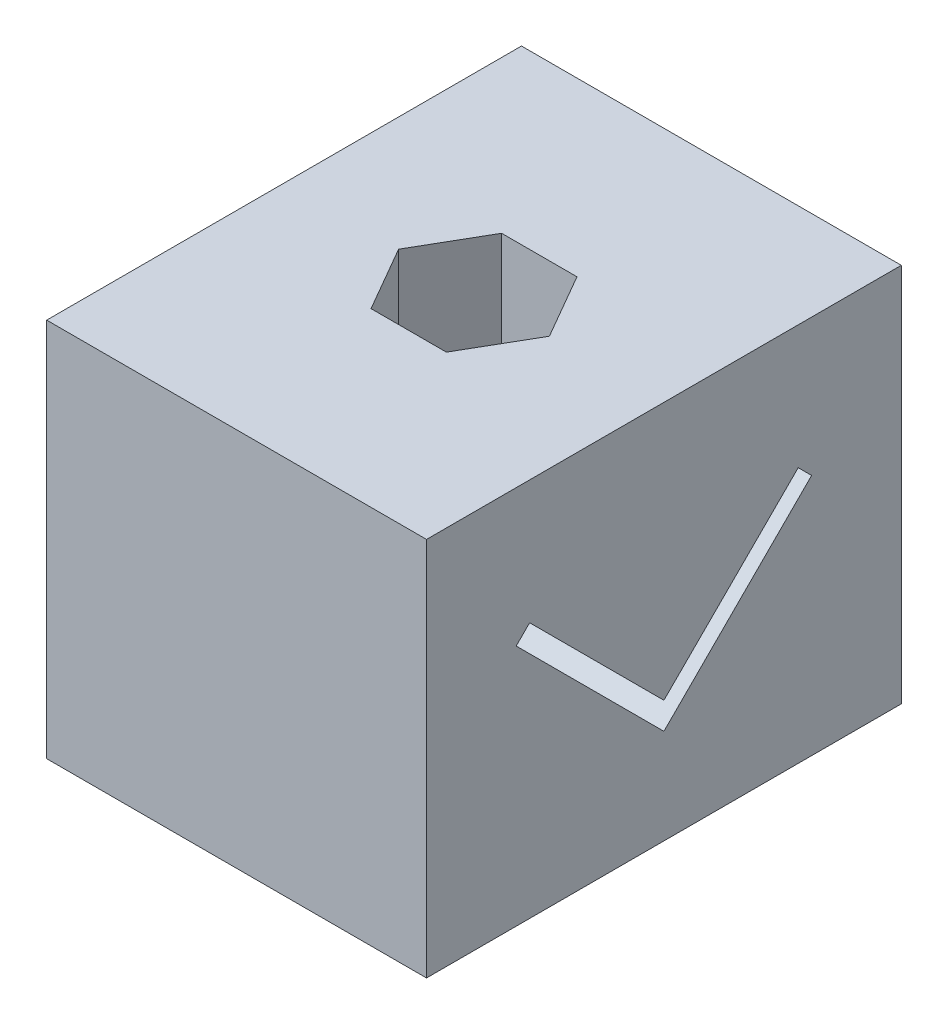
from build123d import *

# Parameters (mm, degrees)
BOSS_EXTRUDE1_DEPTH         = 15.875
CUT_EXTRUDE1_DEPTH          = 152.4
F_1_4_0_25_DIAMETER_HOLE1_D = 3.96875
CUT_EXTRUDE2_DEPTH          = 11.43
SKETCH8_R                   = 3.96875
CUT_EXTRUDE3_DEPTH          = 5.08


with BuildPart() as part:
    # Sketch1 → Boss-Extrude1 (new, symmetric)
    with BuildSketch(Plane.XY):
        Polygon((0, 0), (12.7, 0), (12.7, 25.4), (-12.7, 25.4), (-12.7, 0), align=None)
    extrude(amount=BOSS_EXTRUDE1_DEPTH, both=True)

    # Sketch2 → Cut-Extrude1 (cut)
    with BuildSketch(Plane.ZY.offset(12.7)):
        Polygon((0, 8.146051224), (-8.980256121, 17.126307345), (-9.878281733, 16.228281733), (0, 6.35), (9.878281733, 16.228281733), (8.980256121, 17.126307345), align=None)
    extrude(amount=-CUT_EXTRUDE1_DEPTH, mode=Mode.SUBTRACT)

    # 1/4 (0.25) Diameter Hole1 (through all)
    with Locations(Plane(origin=(0, 25.4, 0), x_dir=(1, 0, 0), z_dir=(0, 1, 0))):
        with Locations((0, 0), (76.2, 0)):
            Hole(F_1_4_0_25_DIAMETER_HOLE1_D / 2)

    # Sketch7 → Cut-Extrude2 (cut)
    with BuildSketch(Plane(origin=(0, 25.4, 0), x_dir=(1, 0, 0), z_dir=(0, 1, 0))):
        Polygon((5.040989538, 0), (2.520494769, 4.365625), (-2.520494769, 4.365625), (-5.040989538, 0), (-2.520494769, -4.365625), (2.520494769, -4.365625), align=None)
    extrude(amount=-CUT_EXTRUDE2_DEPTH, mode=Mode.SUBTRACT)

    # Sketch8 → Cut-Extrude3 (cut)
    with BuildSketch(Plane.XZ):
        Circle(SKETCH8_R)
    extrude(amount=-CUT_EXTRUDE3_DEPTH, mode=Mode.SUBTRACT)


solid = part.part
